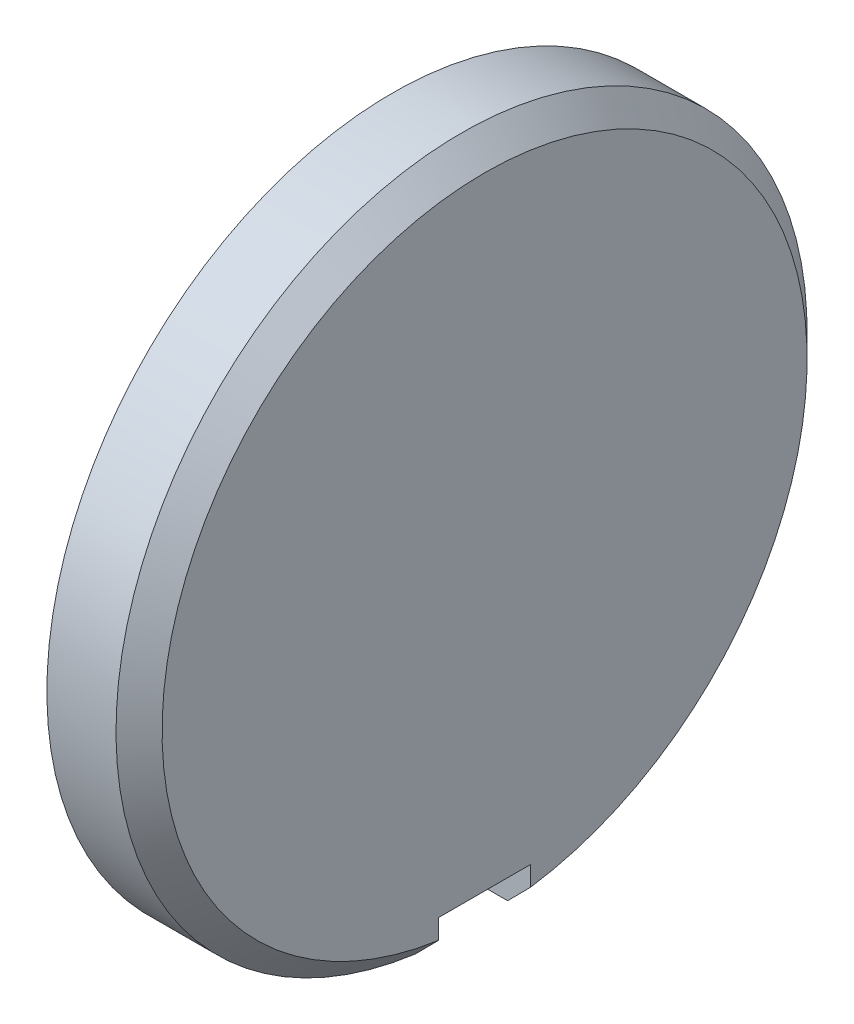
from build123d import *

# Parameters (mm, degrees)
BOSS_EXTRUDE1_START = 62.8
SKETCH2_W           = 1.28
SKETCH2_H           = 0.8
BOSS_EXTRUDE1_DEPTH = 6.4
BOSS_EXTRUDE2_START = 65.6
SKETCH3_W           = 1.28
SKETCH3_H           = 6.4
BOSS_EXTRUDE2_DEPTH = 0.8
BOSS_EXTRUDE3_START = 65.2
SKETCH4_W           = 1.8
SKETCH4_H           = 0.9
BOSS_EXTRUDE3_DEPTH = 1.6


with BuildPart() as part:
    # Sketch1 → Revolve1 (revolve)
    with BuildSketch(Plane.XY.offset(66)):
        Polygon((74, -17.7), (75.2, -17.7), (75.2, -20), (76.8, -20), (76.8, -14.4), (76.4, -14), (75.2, -14), (75.2, -17), (74, -17), align=None)
    revolve(axis=Axis((69, -20, 66), (1, 0, 0)))


with BuildPart() as body_2:
    # Sketch2 → Boss-Extrude1 (new body)
    with BuildSketch(Plane.XY.offset(BOSS_EXTRUDE1_START)):
        with Locations((74.54, -20)):
            Rectangle(SKETCH2_W, SKETCH2_H)
    extrude(amount=BOSS_EXTRUDE1_DEPTH)


with BuildPart() as part_1:
    add(part.part)

    # Combine1: cut body 2
    add(body_2.part, mode=Mode.SUBTRACT)


with BuildPart() as body_2_2:
    # Sketch3 → Boss-Extrude2 (new body)
    with BuildSketch(Plane.XY.offset(BOSS_EXTRUDE2_START)):
        with Locations((74.54, -20)):
            Rectangle(SKETCH3_W, SKETCH3_H)
    extrude(amount=BOSS_EXTRUDE2_DEPTH)


with BuildPart() as part_2:
    add(part_1.part)

    # Combine2: cut body 2 2
    add(body_2_2.part, mode=Mode.SUBTRACT)


with BuildPart() as body_2_3:
    # Sketch4 → Boss-Extrude3 (new body)
    with BuildSketch(Plane.XY.offset(BOSS_EXTRUDE3_START)):
        with Locations((76, -25.65)):
            Rectangle(SKETCH4_W, SKETCH4_H)
    extrude(amount=BOSS_EXTRUDE3_DEPTH)


with BuildPart() as part_3:
    add(part_2.part)

    # Combine3: cut body 2 3
    add(body_2_3.part, mode=Mode.SUBTRACT)


solid = part_3.part
